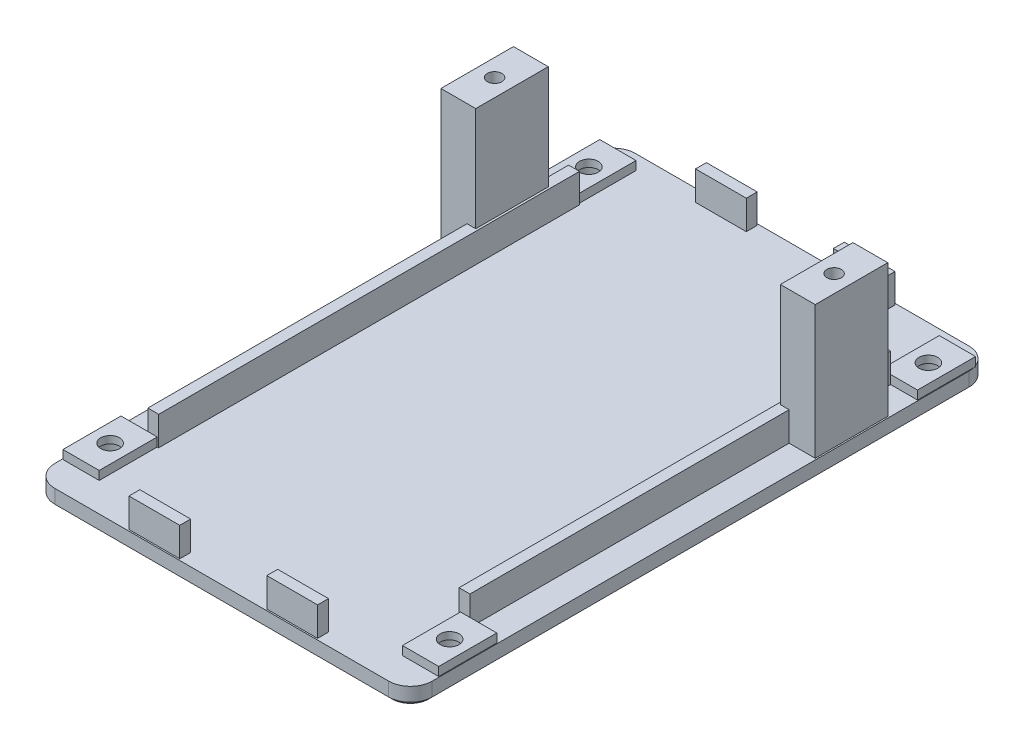
from build123d import *

# Parameters (mm, degrees)
BOSS_EXTRUDE1_DEPTH  = 2.4
CHAMFER1_SIZE        = 0.5
BOSS_EXTRUDE2_START  = -52
SKETCH2_W            = 5
SKETCH2_H            = 1.21
BOSS_EXTRUDE2_DEPTH  = 8
BOSS_EXTRUDE3_START  = 14
SKETCH3_W            = 5
SKETCH3_H            = 1.21
BOSS_EXTRUDE3_DEPTH  = 8
BOSS_EXTRUDE4_START  = -52
SKETCH4_W            = 5
SKETCH4_H            = 1.21
BOSS_EXTRUDE4_DEPTH  = 8
BOSS_EXTRUDE5_START  = 14
SKETCH5_W            = 5
SKETCH5_H            = 1.21
BOSS_EXTRUDE5_DEPTH  = 8
BOSS_EXTRUDE6_START  = -44
SKETCH6_W            = 1.5
SKETCH6_H            = 4.01
BOSS_EXTRUDE6_DEPTH  = 58
BOSS_EXTRUDE7_START  = -40
SKETCH7_W            = 4.8
SKETCH7_H            = 18.36
BOSS_EXTRUDE7_DEPTH  = 10
BOSS_EXTRUDE8_START  = 8
SKETCH8_R            = 1
BOSS_EXTRUDE8_DEPTH  = 13.75
BOSS_EXTRUDE9_START  = -53.8
SKETCH9_W            = 7
SKETCH9_H            = 4.01
BOSS_EXTRUDE9_DEPTH  = 1.5
BOSS_EXTRUDE10_START = 24.3
SKETCH10_W           = 7
SKETCH10_H           = 4.01
BOSS_EXTRUDE10_DEPTH = 1.5
BOSS_EXTRUDE11_START = -44
SKETCH11_W           = 1.5
SKETCH11_H           = 4.01
BOSS_EXTRUDE11_DEPTH = 58
BOSS_EXTRUDE12_START = -40
SKETCH12_W           = 4.8
SKETCH12_H           = 18.36
BOSS_EXTRUDE12_DEPTH = 10
BOSS_EXTRUDE13_START = 8
SKETCH13_R           = 1
BOSS_EXTRUDE13_DEPTH = 13.75
BOSS_EXTRUDE14_START = -53.8
SKETCH14_W           = 7
SKETCH14_H           = 4.01
BOSS_EXTRUDE14_DEPTH = 1.5
BOSS_EXTRUDE15_START = 24.3
SKETCH15_W           = 7
SKETCH15_H           = 4.01
BOSS_EXTRUDE15_DEPTH = 1.5
BOSS_EXTRUDE16_START = -1
SKETCH16_R           = 2.1
BOSS_EXTRUDE16_DEPTH = 3.6
BOSS_EXTRUDE17_START = 2.5
SKETCH17_R           = 1.3
BOSS_EXTRUDE17_DEPTH = 1.2
BOSS_EXTRUDE18_START = -1
SKETCH18_R           = 2.1
BOSS_EXTRUDE18_DEPTH = 3.6
BOSS_EXTRUDE19_START = 2.5
SKETCH19_R           = 1.3
BOSS_EXTRUDE19_DEPTH = 1.2
BOSS_EXTRUDE20_START = -1
SKETCH20_R           = 2.1
BOSS_EXTRUDE20_DEPTH = 3.6
BOSS_EXTRUDE21_START = 2.5
SKETCH21_R           = 1.3
BOSS_EXTRUDE21_DEPTH = 1.2
BOSS_EXTRUDE22_START = -1
SKETCH22_R           = 2.1
BOSS_EXTRUDE22_DEPTH = 3.6
BOSS_EXTRUDE23_START = 2.5
SKETCH23_R           = 1.3
BOSS_EXTRUDE23_DEPTH = 1.2
BOSS_EXTRUDE24_START = -54.1
SKETCH24_W           = 4
SKETCH24_H           = 0.9
BOSS_EXTRUDE24_DEPTH = 1


with BuildPart() as part:
    # Sketch1 → Boss-Extrude1 (new body)
    with BuildSketch(Plane(origin=(0, 0, 0), x_dir=(1, 0, 0), z_dir=(0, 1, 0))):
        with BuildLine():
            Line((-23, 54), (23, 54))
            ThreePointArc((23, 54), (25.121320344, 53.121320344), (26, 51))
            Line((26, 51), (26, -23))
            ThreePointArc((26, -23), (25.121320344, -25.121320344), (23, -26))
            Line((23, -26), (-23, -26))
            ThreePointArc((-23, -26), (-25.121320344, -25.121320344), (-26, -23))
            Line((-26, -23), (-26, 51))
            ThreePointArc((-26, 51), (-25.121320344, 53.121320344), (-23, 54))
        make_face()
    extrude(amount=BOSS_EXTRUDE1_DEPTH)

    # Chamfer1
    chamfer1_edges = [part.edges().sort_by_distance(p)[0] for p in [
        (0, 0, -54),
        (-25.121320344, 0, -53.121320344),
        (25.121320344, 0, -53.121320344),
        (-26, 0, -14),
        (26, 0, -14),
        (-25.121320344, 0, 25.121320344),
        (25.121320344, 0, 25.121320344),
        (0, 0, 26),
    ]]
    chamfer(chamfer1_edges, length=CHAMFER1_SIZE)

    # Sketch2 → Boss-Extrude2 (add)
    with BuildSketch(Plane.XY.offset(BOSS_EXTRUDE2_START)):
        with Locations((-23.4, 2.995)):
            Rectangle(SKETCH2_W, SKETCH2_H)
    extrude(amount=BOSS_EXTRUDE2_DEPTH)

    # Sketch3 → Boss-Extrude3 (add)
    with BuildSketch(Plane.XY.offset(BOSS_EXTRUDE3_START)):
        with Locations((-23.4, 2.995)):
            Rectangle(SKETCH3_W, SKETCH3_H)
    extrude(amount=BOSS_EXTRUDE3_DEPTH)

    # Sketch4 → Boss-Extrude4 (add)
    with BuildSketch(Plane.XY.offset(BOSS_EXTRUDE4_START)):
        with Locations((23.4, 2.995)):
            Rectangle(SKETCH4_W, SKETCH4_H)
    extrude(amount=BOSS_EXTRUDE4_DEPTH)

    # Sketch5 → Boss-Extrude5 (add)
    with BuildSketch(Plane.XY.offset(BOSS_EXTRUDE5_START)):
        with Locations((23.4, 2.995)):
            Rectangle(SKETCH5_W, SKETCH5_H)
    extrude(amount=BOSS_EXTRUDE5_DEPTH)

    # Sketch6 → Boss-Extrude6 (add)
    with BuildSketch(Plane.XY.offset(BOSS_EXTRUDE6_START)):
        with Locations((-21.45, 4.395)):
            Rectangle(SKETCH6_W, SKETCH6_H)
    extrude(amount=BOSS_EXTRUDE6_DEPTH)

    # Sketch7 → Boss-Extrude7 (add)
    with BuildSketch(Plane.XY.offset(BOSS_EXTRUDE7_START)):
        with Locations((-23.4, 11.57)):
            Rectangle(SKETCH7_W, SKETCH7_H)
    extrude(amount=BOSS_EXTRUDE7_DEPTH)


with BuildPart() as body_2:
    # Sketch8 → Boss-Extrude8 (new body)
    with BuildSketch(Plane(origin=(0, 0, 0), x_dir=(1, 0, 0), z_dir=(0, 1, 0)).offset(BOSS_EXTRUDE8_START)):
        with Locations((-23.4, 35)):
            Circle(SKETCH8_R)
    extrude(amount=BOSS_EXTRUDE8_DEPTH)


with BuildPart() as part_1:
    add(part.part)

    # Combine1: cut body 2
    add(body_2.part, mode=Mode.SUBTRACT)

    # Sketch9 → Boss-Extrude9 (add)
    with BuildSketch(Plane.XY.offset(BOSS_EXTRUDE9_START)):
        with Locations((-9.5, 4.395)):
            Rectangle(SKETCH9_W, SKETCH9_H)
    extrude(amount=BOSS_EXTRUDE9_DEPTH)

    # Sketch10 → Boss-Extrude10 (add)
    with BuildSketch(Plane.XY.offset(BOSS_EXTRUDE10_START)):
        with Locations((-9.5, 4.395)):
            Rectangle(SKETCH10_W, SKETCH10_H)
    extrude(amount=BOSS_EXTRUDE10_DEPTH)

    # Sketch11 → Boss-Extrude11 (add)
    with BuildSketch(Plane.XY.offset(BOSS_EXTRUDE11_START)):
        with Locations((21.45, 4.395)):
            Rectangle(SKETCH11_W, SKETCH11_H)
    extrude(amount=BOSS_EXTRUDE11_DEPTH)

    # Sketch12 → Boss-Extrude12 (add)
    with BuildSketch(Plane.XY.offset(BOSS_EXTRUDE12_START)):
        with Locations((23.4, 11.57)):
            Rectangle(SKETCH12_W, SKETCH12_H)
    extrude(amount=BOSS_EXTRUDE12_DEPTH)


with BuildPart() as body_2_2:
    # Sketch13 → Boss-Extrude13 (new body)
    with BuildSketch(Plane(origin=(0, 0, 0), x_dir=(1, 0, 0), z_dir=(0, 1, 0)).offset(BOSS_EXTRUDE13_START)):
        with Locations((23.4, 35)):
            Circle(SKETCH13_R)
    extrude(amount=BOSS_EXTRUDE13_DEPTH)


with BuildPart() as part_2:
    add(part_1.part)

    # Combine2: cut body 2 2
    add(body_2_2.part, mode=Mode.SUBTRACT)

    # Sketch14 → Boss-Extrude14 (add)
    with BuildSketch(Plane.XY.offset(BOSS_EXTRUDE14_START)):
        with Locations((9.5, 4.395)):
            Rectangle(SKETCH14_W, SKETCH14_H)
    extrude(amount=BOSS_EXTRUDE14_DEPTH)

    # Sketch15 → Boss-Extrude15 (add)
    with BuildSketch(Plane.XY.offset(BOSS_EXTRUDE15_START)):
        with Locations((9.5, 4.395)):
            Rectangle(SKETCH15_W, SKETCH15_H)
    extrude(amount=BOSS_EXTRUDE15_DEPTH)


with BuildPart() as body_2_3:
    # Sketch16 → Boss-Extrude16 (new body)
    with BuildSketch(Plane(origin=(0, 0, 0), x_dir=(1, 0, 0), z_dir=(0, 1, 0)).offset(BOSS_EXTRUDE16_START)):
        with Locations((-23.4, 48)):
            Circle(SKETCH16_R)
    extrude(amount=BOSS_EXTRUDE16_DEPTH)


with BuildPart() as part_3:
    add(part_2.part)

    # Combine3: cut body 2 3
    add(body_2_3.part, mode=Mode.SUBTRACT)


with BuildPart() as body_2_4:
    # Sketch17 → Boss-Extrude17 (new body)
    with BuildSketch(Plane(origin=(0, 0, 0), x_dir=(1, 0, 0), z_dir=(0, 1, 0)).offset(BOSS_EXTRUDE17_START)):
        with Locations((-23.4, 48)):
            Circle(SKETCH17_R)
    extrude(amount=BOSS_EXTRUDE17_DEPTH)


with BuildPart() as part_4:
    add(part_3.part)

    # Combine4: cut body 2 4
    add(body_2_4.part, mode=Mode.SUBTRACT)


with BuildPart() as body_2_5:
    # Sketch18 → Boss-Extrude18 (new body)
    with BuildSketch(Plane(origin=(0, 0, 0), x_dir=(1, 0, 0), z_dir=(0, 1, 0)).offset(BOSS_EXTRUDE18_START)):
        with Locations((-23.4, -18)):
            Circle(SKETCH18_R)
    extrude(amount=BOSS_EXTRUDE18_DEPTH)


with BuildPart() as part_5:
    add(part_4.part)

    # Combine5: cut body 2 5
    add(body_2_5.part, mode=Mode.SUBTRACT)


with BuildPart() as body_2_6:
    # Sketch19 → Boss-Extrude19 (new body)
    with BuildSketch(Plane(origin=(0, 0, 0), x_dir=(1, 0, 0), z_dir=(0, 1, 0)).offset(BOSS_EXTRUDE19_START)):
        with Locations((-23.4, -18)):
            Circle(SKETCH19_R)
    extrude(amount=BOSS_EXTRUDE19_DEPTH)


with BuildPart() as part_6:
    add(part_5.part)

    # Combine6: cut body 2 6
    add(body_2_6.part, mode=Mode.SUBTRACT)


with BuildPart() as body_2_7:
    # Sketch20 → Boss-Extrude20 (new body)
    with BuildSketch(Plane(origin=(0, 0, 0), x_dir=(1, 0, 0), z_dir=(0, 1, 0)).offset(BOSS_EXTRUDE20_START)):
        with Locations((23.4, 48)):
            Circle(SKETCH20_R)
    extrude(amount=BOSS_EXTRUDE20_DEPTH)


with BuildPart() as part_7:
    add(part_6.part)

    # Combine7: cut body 2 7
    add(body_2_7.part, mode=Mode.SUBTRACT)


with BuildPart() as body_2_8:
    # Sketch21 → Boss-Extrude21 (new body)
    with BuildSketch(Plane(origin=(0, 0, 0), x_dir=(1, 0, 0), z_dir=(0, 1, 0)).offset(BOSS_EXTRUDE21_START)):
        with Locations((23.4, 48)):
            Circle(SKETCH21_R)
    extrude(amount=BOSS_EXTRUDE21_DEPTH)


with BuildPart() as part_8:
    add(part_7.part)

    # Combine8: cut body 2 8
    add(body_2_8.part, mode=Mode.SUBTRACT)


with BuildPart() as body_2_9:
    # Sketch22 → Boss-Extrude22 (new body)
    with BuildSketch(Plane(origin=(0, 0, 0), x_dir=(1, 0, 0), z_dir=(0, 1, 0)).offset(BOSS_EXTRUDE22_START)):
        with Locations((23.4, -18)):
            Circle(SKETCH22_R)
    extrude(amount=BOSS_EXTRUDE22_DEPTH)


with BuildPart() as part_9:
    add(part_8.part)

    # Combine9: cut body 2 9
    add(body_2_9.part, mode=Mode.SUBTRACT)


with BuildPart() as body_2_10:
    # Sketch23 → Boss-Extrude23 (new body)
    with BuildSketch(Plane(origin=(0, 0, 0), x_dir=(1, 0, 0), z_dir=(0, 1, 0)).offset(BOSS_EXTRUDE23_START)):
        with Locations((23.4, -18)):
            Circle(SKETCH23_R)
    extrude(amount=BOSS_EXTRUDE23_DEPTH)


with BuildPart() as part_10:
    add(part_9.part)

    # Combine10: cut body 2 10
    add(body_2_10.part, mode=Mode.SUBTRACT)


with BuildPart() as body_2_11:
    # Sketch24 → Boss-Extrude24 (new body)
    with BuildSketch(Plane.XY.offset(BOSS_EXTRUDE24_START)):
        with Locations((0, 0.35)):
            Rectangle(SKETCH24_W, SKETCH24_H)
    extrude(amount=BOSS_EXTRUDE24_DEPTH)


with BuildPart() as part_11:
    add(part_10.part)

    # Combine11: cut body 2 11
    add(body_2_11.part, mode=Mode.SUBTRACT)


solid = part_11.part
